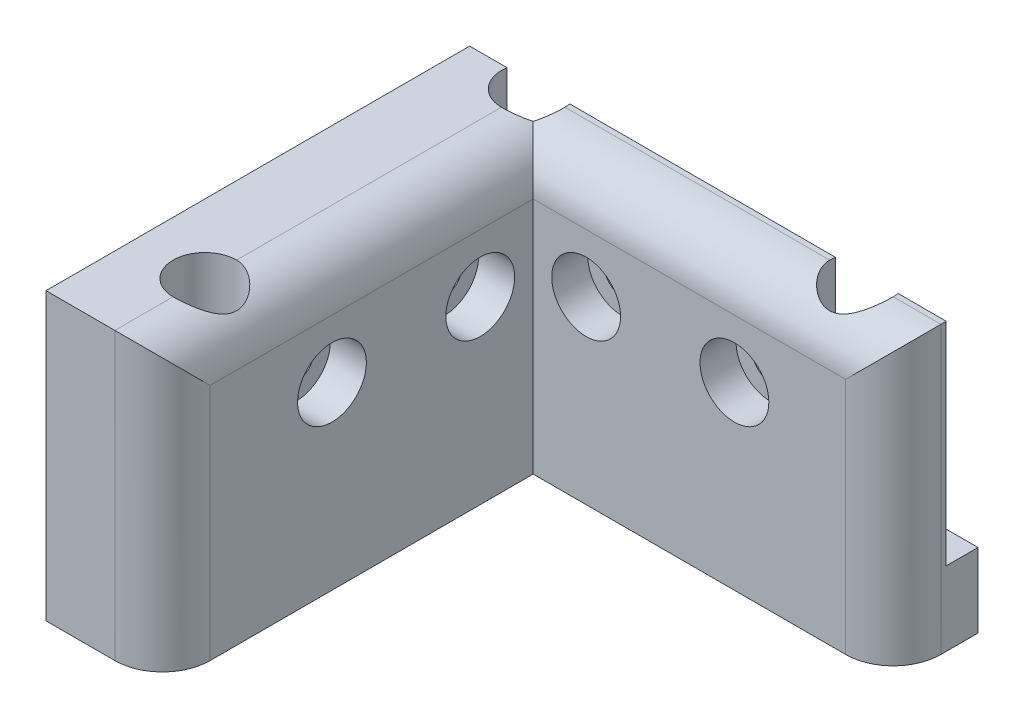
from build123d import *

# Parameters (mm, degrees)
SKETCH1_W                                           = 45
SKETCH1_H                                           = 40
BOSS_EXTRUDE1_DEPTH                                 = 29
SKETCH33_W                                          = 34
SKETCH33_H                                          = 35
CUT_EXTRUDE7_DEPTH                                  = 67.828137786
SKETCH39_W                                          = 45
SKETCH39_H                                          = 9
BOSS_EXTRUDE2_DEPTH                                 = 3
CUT_EXTRUDE6_DEPTH                                  = 69.6658576
CUT_EXTRUDE6_DEPTH_BACK                             = 69.6658576
SKETCH21_R                                          = 1.75
SKETCH34_R                                          = 3
CUT_EXTRUDE8_DEPTH                                  = 23
CBORE_FOR_M3_HEX_SOCKET_HEAD_CAP_SCREW1_D           = 3.4
CBORE_FOR_M3_HEX_SOCKET_HEAD_CAP_SCREW1_CBORE_D     = 6.5
CBORE_FOR_M3_HEX_SOCKET_HEAD_CAP_SCREW1_CBORE_DEPTH = 3.4
CBORE_FOR_M3_HEX_SOCKET_HEAD_CAP_SCREW2_D           = 3.4
CBORE_FOR_M3_HEX_SOCKET_HEAD_CAP_SCREW2_CBORE_D     = 6.5
CBORE_FOR_M3_HEX_SOCKET_HEAD_CAP_SCREW2_CBORE_DEPTH = 3.4
FILLET1_R                                           = 4.5
SKETCH40_W                                          = 43
SKETCH40_H                                          = 2
CUT_EXTRUDE9_DEPTH                                  = 69.665857708


with BuildPart() as part:
    # Sketch1 → Boss-Extrude1 (new body)
    with BuildSketch(Plane(origin=(0, 0, 0), x_dir=(1, 0, 0), z_dir=(0, 1, 0))):
        with Locations((22.5, 20)):
            Rectangle(SKETCH1_W, SKETCH1_H)
    extrude(amount=BOSS_EXTRUDE1_DEPTH)

    # Sketch33 → Cut-Extrude7 (cut, through all)
    with BuildSketch(Plane(origin=(0, 29, 0), x_dir=(1, 0, 0), z_dir=(0, 1, 0))):
        with Locations((28, 17.5)):
            Rectangle(SKETCH33_W, SKETCH33_H)
    extrude(amount=-CUT_EXTRUDE7_DEPTH, mode=Mode.SUBTRACT)

    # Sketch39 → Boss-Extrude2 (add)
    with BuildSketch(Plane(origin=(0, 0, -40), x_dir=(-1, 0, 0), z_dir=(0, 0, -1))):
        with Locations((-22.5, 4.5)):
            Rectangle(SKETCH39_W, SKETCH39_H)
    extrude(amount=BOSS_EXTRUDE2_DEPTH)

    # Sketch21 → Cut-Extrude6 (cut, two sides: drawn at the far end of the back side and taken through both)
    with BuildSketch(Plane(origin=(0, 29, 0), x_dir=(1, 0, 0), z_dir=(0, 1, 0)).offset(-CUT_EXTRUDE6_DEPTH_BACK)):
        with Locations(Location((6.5, 39.5, 0), (0, 0, 270))):
            Circle(SKETCH21_R)
        with Locations(Location((6.5, 8.5, 0), (0, 0, 270))):
            Circle(SKETCH21_R)
        with Locations(Location((37.5, 39.5, 0), (0, 0, 270))):
            Circle(SKETCH21_R)
    extrude(amount=CUT_EXTRUDE6_DEPTH + CUT_EXTRUDE6_DEPTH_BACK, mode=Mode.SUBTRACT)

    # Sketch34 → Cut-Extrude8 (cut)
    with BuildSketch(Plane(origin=(0, 29, 0), x_dir=(1, 0, 0), z_dir=(0, 1, 0))):
        with Locations(Location((6.5, 8.5, 0), (0, 0, 270))):
            Circle(SKETCH34_R)
        with Locations(Location((6.5, 39.5, 0), (0, 0, 270))):
            Circle(SKETCH34_R)
        with Locations(Location((37.5, 39.5, 0), (0, 0, 270))):
            Circle(SKETCH34_R)
    extrude(amount=-CUT_EXTRUDE8_DEPTH, mode=Mode.SUBTRACT)

    # CBORE for M3 Hex Socket Head Cap Screw1 (through all)
    with Locations(Plane(origin=(11, 0, 0), x_dir=(0, 0, -1), z_dir=(1, 0, 0))):
        with Locations((16, 19), (30, 19)):
            CounterBoreHole(CBORE_FOR_M3_HEX_SOCKET_HEAD_CAP_SCREW1_D / 2, CBORE_FOR_M3_HEX_SOCKET_HEAD_CAP_SCREW1_CBORE_D / 2, CBORE_FOR_M3_HEX_SOCKET_HEAD_CAP_SCREW1_CBORE_DEPTH)

    # CBORE for M3 Hex Socket Head Cap Screw2 (through all)
    with Locations(Plane.XY.offset(-35)):
        with Locations((16, 19), (30, 19)):
            CounterBoreHole(CBORE_FOR_M3_HEX_SOCKET_HEAD_CAP_SCREW2_D / 2, CBORE_FOR_M3_HEX_SOCKET_HEAD_CAP_SCREW2_CBORE_D / 2, CBORE_FOR_M3_HEX_SOCKET_HEAD_CAP_SCREW2_CBORE_DEPTH)

    # Fillet1
    # the kernel refuses this fillet: 4.5 mm, written as the material it takes off along each edge
    with BuildSketch(Plane(origin=(45, 29, -35), x_dir=(0, 0, -1), z_dir=(0, -1, 0))) as fillet1_piece_1:
        with BuildLine():
            CenterArc((FILLET1_R, -FILLET1_R), FILLET1_R, 90, 90)
            Line((0, -FILLET1_R), (-FILLET1_R * 0.02, -FILLET1_R))
            Line((-FILLET1_R * 0.02, -FILLET1_R), (-FILLET1_R * 0.02, FILLET1_R * 0.02))
            Line((-FILLET1_R * 0.02, FILLET1_R * 0.02), (FILLET1_R, FILLET1_R * 0.02))
            Line((FILLET1_R, FILLET1_R * 0.02), (FILLET1_R, 0))
        make_face()
    extrude(amount=29, mode=Mode.SUBTRACT)
    with BuildSketch(Plane(origin=(11, 29, 0), x_dir=(-1, 0, 0), z_dir=(0, -1, 0))) as fillet1_piece_2:
        with BuildLine():
            CenterArc((FILLET1_R, FILLET1_R), FILLET1_R, 180, 90)
            Line((0, FILLET1_R), (-FILLET1_R * 0.02, FILLET1_R))
            Line((-FILLET1_R * 0.02, FILLET1_R), (-FILLET1_R * 0.02, -FILLET1_R * 0.02))
            Line((-FILLET1_R * 0.02, -FILLET1_R * 0.02), (FILLET1_R, -FILLET1_R * 0.02))
            Line((FILLET1_R, -FILLET1_R * 0.02), (FILLET1_R, 0))
        make_face()
    extrude(amount=29, mode=Mode.SUBTRACT)
    with BuildSketch(Plane(origin=(11, 29, -35), x_dir=(0, 0, -1), z_dir=(1, 0, 0))) as fillet1_piece_3:
        with BuildLine():
            CenterArc((FILLET1_R, -FILLET1_R), FILLET1_R, 90, 90)
            Line((0, -FILLET1_R), (-FILLET1_R * 0.02, -FILLET1_R))
            Line((-FILLET1_R * 0.02, -FILLET1_R), (-FILLET1_R * 0.02, FILLET1_R * 0.02))
            Line((-FILLET1_R * 0.02, FILLET1_R * 0.02), (FILLET1_R, FILLET1_R * 0.02))
            Line((FILLET1_R, FILLET1_R * 0.02), (FILLET1_R, 0))
        make_face()
    extrude(amount=34, mode=Mode.SUBTRACT)
    with BuildSketch(Plane(origin=(11, 29, 0), x_dir=(0, -1, 0), z_dir=(0, 0, -1))) as fillet1_piece_4:
        with BuildLine():
            CenterArc((FILLET1_R, FILLET1_R), FILLET1_R, 180, 90)
            Line((0, FILLET1_R), (-FILLET1_R * 0.02, FILLET1_R))
            Line((-FILLET1_R * 0.02, FILLET1_R), (-FILLET1_R * 0.02, -FILLET1_R * 0.02))
            Line((-FILLET1_R * 0.02, -FILLET1_R * 0.02), (FILLET1_R, -FILLET1_R * 0.02))
            Line((FILLET1_R, -FILLET1_R * 0.02), (FILLET1_R, 0))
        make_face()
    extrude(amount=35, mode=Mode.SUBTRACT)
    with BuildSketch(Plane(origin=(11, 29, -35), x_dir=(0, 0, -1), z_dir=(1, 0, 0))) as fillet1_piece_5a_section:
        with BuildLine():
            CenterArc((FILLET1_R, -FILLET1_R), FILLET1_R, 90, 90)
            Line((0, -FILLET1_R), (-FILLET1_R * 0.02, -FILLET1_R))
            Line((-FILLET1_R * 0.02, -FILLET1_R), (-FILLET1_R * 0.02, FILLET1_R * 0.02))
            Line((-FILLET1_R * 0.02, FILLET1_R * 0.02), (FILLET1_R, FILLET1_R * 0.02))
            Line((FILLET1_R, FILLET1_R * 0.02), (FILLET1_R, 0))
        make_face()
    fillet1_piece_5a = extrude(amount=45.25, mode=Mode.PRIVATE)
    fillet1_piece_5a = split(fillet1_piece_5a, bisect_by=Plane(origin=(45, 27.981221986, -36.018778014), z_dir=(1, 0, 0)), keep=Keep.TOP, mode=Mode.PRIVATE)
    with BuildSketch(Plane(origin=(45, 40.25, -35), x_dir=(0, 0, -1), z_dir=(0, -1, 0))) as fillet1_piece_5b_section:
        with BuildLine():
            CenterArc((FILLET1_R, -FILLET1_R), FILLET1_R, 90, 90)
            Line((0, -FILLET1_R), (-FILLET1_R * 0.02, -FILLET1_R))
            Line((-FILLET1_R * 0.02, -FILLET1_R), (-FILLET1_R * 0.02, FILLET1_R * 0.02))
            Line((-FILLET1_R * 0.02, FILLET1_R * 0.02), (FILLET1_R, FILLET1_R * 0.02))
            Line((FILLET1_R, FILLET1_R * 0.02), (FILLET1_R, 0))
        make_face()
    fillet1_piece_5b = extrude(amount=40.25, mode=Mode.PRIVATE)
    fillet1_piece_5b = split(fillet1_piece_5b, bisect_by=Plane(origin=(43.981221986, 29, -36.018778014), z_dir=(0, 1, 0)), keep=Keep.TOP, mode=Mode.PRIVATE)
    fillet1_piece_5 = fillet1_piece_5a & fillet1_piece_5b
    add(fillet1_piece_5, mode=Mode.SUBTRACT)
    with BuildSketch(Plane(origin=(11, 40.25, 0), x_dir=(-1, 0, 0), z_dir=(0, -1, 0))) as fillet1_piece_6a_section:
        with BuildLine():
            CenterArc((FILLET1_R, FILLET1_R), FILLET1_R, 180, 90)
            Line((0, FILLET1_R), (-FILLET1_R * 0.02, FILLET1_R))
            Line((-FILLET1_R * 0.02, FILLET1_R), (-FILLET1_R * 0.02, -FILLET1_R * 0.02))
            Line((-FILLET1_R * 0.02, -FILLET1_R * 0.02), (FILLET1_R, -FILLET1_R * 0.02))
            Line((FILLET1_R, -FILLET1_R * 0.02), (FILLET1_R, 0))
        make_face()
    fillet1_piece_6a = extrude(amount=40.25, mode=Mode.PRIVATE)
    fillet1_piece_6a = split(fillet1_piece_6a, bisect_by=Plane(origin=(9.981221986, 29, -1.018778014), z_dir=(0, 1, 0)), keep=Keep.TOP, mode=Mode.PRIVATE)
    with BuildSketch(Plane(origin=(11, 29, 11.25), x_dir=(0, -1, 0), z_dir=(0, 0, -1))) as fillet1_piece_6b_section:
        with BuildLine():
            CenterArc((FILLET1_R, FILLET1_R), FILLET1_R, 180, 90)
            Line((0, FILLET1_R), (-FILLET1_R * 0.02, FILLET1_R))
            Line((-FILLET1_R * 0.02, FILLET1_R), (-FILLET1_R * 0.02, -FILLET1_R * 0.02))
            Line((-FILLET1_R * 0.02, -FILLET1_R * 0.02), (FILLET1_R, -FILLET1_R * 0.02))
            Line((FILLET1_R, -FILLET1_R * 0.02), (FILLET1_R, 0))
        make_face()
    fillet1_piece_6b = extrude(amount=46.25, mode=Mode.PRIVATE)
    fillet1_piece_6b = split(fillet1_piece_6b, bisect_by=Plane(origin=(9.981221986, 27.981221986, 0), z_dir=(0, 0, 1)), keep=Keep.TOP, mode=Mode.PRIVATE)
    fillet1_piece_6 = fillet1_piece_6a & fillet1_piece_6b
    add(fillet1_piece_6, mode=Mode.SUBTRACT)
    with BuildSketch(Plane(origin=(11, 29, 0), x_dir=(0, -1, 0), z_dir=(0, 0, -1))) as fillet1_piece_7a_section:
        with BuildLine():
            CenterArc((FILLET1_R, FILLET1_R), FILLET1_R, 180, 90)
            Line((0, FILLET1_R), (-FILLET1_R * 0.02, FILLET1_R))
            Line((-FILLET1_R * 0.02, FILLET1_R), (-FILLET1_R * 0.02, -FILLET1_R * 0.02))
            Line((-FILLET1_R * 0.02, -FILLET1_R * 0.02), (FILLET1_R, -FILLET1_R * 0.02))
            Line((FILLET1_R, -FILLET1_R * 0.02), (FILLET1_R, 0))
        make_face()
    fillet1_piece_7a = extrude(amount=46.25, mode=Mode.PRIVATE)
    fillet1_piece_7a = split(fillet1_piece_7a, bisect_by=Plane(origin=(9.981221986, 27.981221986, -35), z_dir=(0, 0, -1)), keep=Keep.TOP, mode=Mode.PRIVATE)
    with BuildSketch(Plane(origin=(-0.25, 29, -35), x_dir=(0, 0, -1), z_dir=(1, 0, 0))) as fillet1_piece_7b_section:
        with BuildLine():
            CenterArc((FILLET1_R, -FILLET1_R), FILLET1_R, 90, 90)
            Line((0, -FILLET1_R), (-FILLET1_R * 0.02, -FILLET1_R))
            Line((-FILLET1_R * 0.02, -FILLET1_R), (-FILLET1_R * 0.02, FILLET1_R * 0.02))
            Line((-FILLET1_R * 0.02, FILLET1_R * 0.02), (FILLET1_R, FILLET1_R * 0.02))
            Line((FILLET1_R, FILLET1_R * 0.02), (FILLET1_R, 0))
        make_face()
    fillet1_piece_7b = extrude(amount=45.25, mode=Mode.PRIVATE)
    fillet1_piece_7b = split(fillet1_piece_7b, bisect_by=Plane(origin=(11, 27.981221986, -36.018778014), z_dir=(-1, 0, 0)), keep=Keep.TOP, mode=Mode.PRIVATE)
    fillet1_piece_7 = fillet1_piece_7a & fillet1_piece_7b
    add(fillet1_piece_7, mode=Mode.SUBTRACT)

    # Sketch40 → Cut-Extrude9 (cut, through all)
    with BuildSketch(Plane.ZY):
        with Locations((-21.5, 1)):
            Rectangle(SKETCH40_W, SKETCH40_H)
    extrude(amount=-CUT_EXTRUDE9_DEPTH, mode=Mode.SUBTRACT)


solid = part.part
